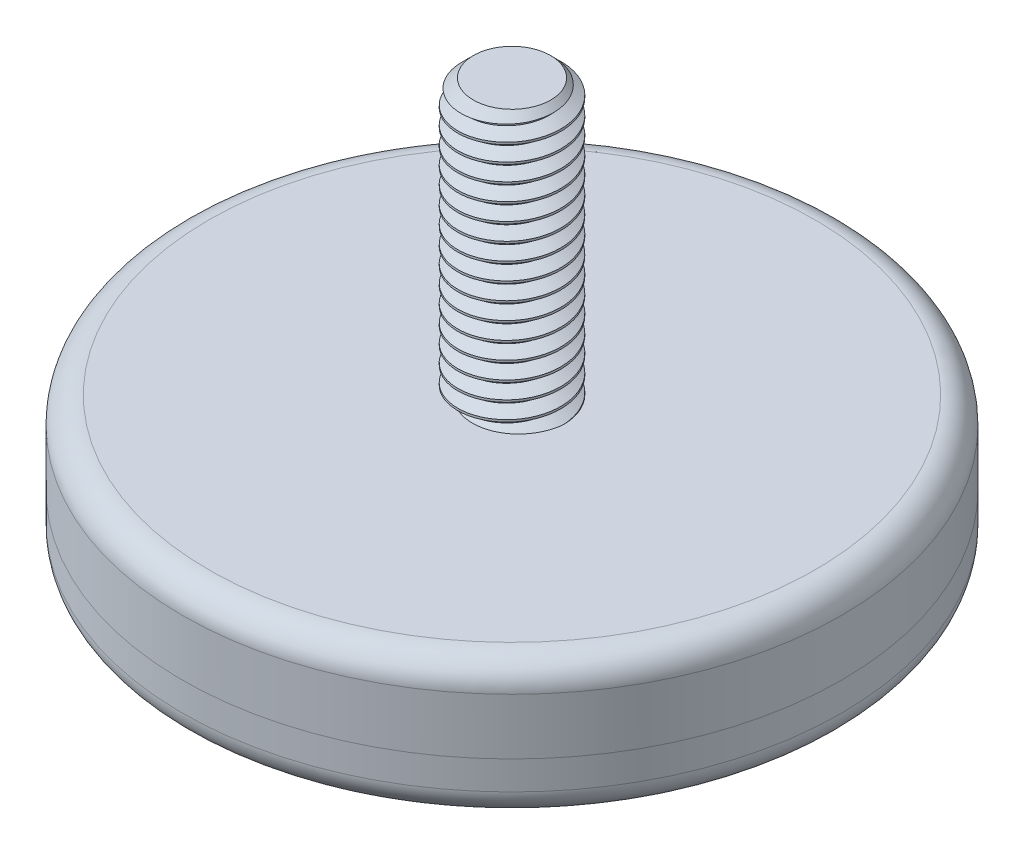
from build123d import *

# Parameters (mm, degrees)
SKETCH1_W               = 4.7625
SKETCH1_H               = 38.1
CUT_SWEEP4_PITCH        = 1.5875
CUT_EXTRUDE1_DEPTH      = 39.690733025
CUT_EXTRUDE1_DEPTH_BACK = 39.690733025
SKETCH5_W               = 2.316222992
SKETCH5_H               = 12.7
SKETCH6_W               = 30.48
SKETCH6_H               = 7.62
FILLET1_R               = 2.4384
SKETCH8_W               = 30.48
SKETCH8_H               = 5.08
SKETCH8_3_W             = 30.48
SKETCH8_3_H             = 5.08
FILLET2_R               = 2.4384


with BuildPart() as part:
    # Sketch1 → Revolve1 (revolve)
    with BuildSketch(Plane.XY):
        with Locations((2.38125, 19.05)):
            Rectangle(SKETCH1_W, SKETCH1_H)
    revolve(axis=Axis((0, 0, 0), (0, 1, 0)))

    # Cut-Sweep4: arcs per turn and ends read off the stored shape
    # Cut-Sweep4: the profile of Sketch4 profile screwed along a right-hand helix through 26 turns, 8 arcs to a turn; built about Z, then put on its axis
    cut_sweep4_z = Axis((0, 0, 0), (0, 0, 1))
    cut_sweep4_corners = [(4.7628, 0, -1.587326795), (3.731388504, 0, -2.1828125), (3.731388504, 0, -2.38125), (4.7628, 0, -2.976735705)]
    with BuildLine(mode=Mode.PRIVATE) as cut_sweep4_profile:
        Line(cut_sweep4_corners[0], cut_sweep4_corners[1])
        Line(cut_sweep4_corners[1], cut_sweep4_corners[2])
        Line(cut_sweep4_corners[2], cut_sweep4_corners[3])
        Line(cut_sweep4_corners[3], cut_sweep4_corners[0])
    cut_sweep4_cap = Face(cut_sweep4_profile.wire())
    cut_sweep4_turn_angles = [0, 22.5, 45, 67.5, 90, 112.5, 135, 157.5, 180, 202.5, 225, 247.5, 270, 292.5, 315, 337.5, 360]
    cut_sweep4_turn_weights = [1, 0.9238795325112867, 1, 0.9238795325112867, 1, 0.9238795325112867, 1, 0.9238795325112867, 1, 0.9238795325112867, 1, 0.9238795325112867, 1, 0.9238795325112867, 1, 0.9238795325112867, 1]
    cut_sweep4_turn_rails = [Edge.make_bspline([Vector(p[0], p[1], 0).rotate(cut_sweep4_z, cut_sweep4_turn_angles[k]) / cut_sweep4_turn_weights[k] + Vector(0, 0, p[2] + CUT_SWEEP4_PITCH * cut_sweep4_turn_angles[k] / 360) for k in range(17)], [0, 0, 0, 1, 1, 2, 2, 3, 3, 4, 4, 5, 5, 6, 6, 7, 7, 8, 8, 8], 2, cut_sweep4_turn_weights) for p in cut_sweep4_corners]
    cut_sweep4_turn_sides = [Face.make_surface_from_curves(cut_sweep4_turn_rails[p[0]], cut_sweep4_turn_rails[p[1]]) for p in [(0, 1), (1, 2), (2, 3), (3, 0)]]
    cut_sweep4 = Plane(origin=(0, 38.1, 0), x_dir=(1, 0, 0), z_dir=(0, -1, 0)) * Solid(Shell([*[p.moved(Location((0, 0, CUT_SWEEP4_PITCH * i))) for i in range(26) for p in cut_sweep4_turn_sides], cut_sweep4_cap, cut_sweep4_cap.rotate(cut_sweep4_z, 9360).moved(Location((0, 0, CUT_SWEEP4_PITCH * 9360 / 360)))]))
    add(cut_sweep4, mode=Mode.SUBTRACT)

    # Sketch9 → Cut-Revolve2 (revolve, cut)
    with BuildSketch(Plane.XY):
        Polygon((4.7625, 36.909375), (3.571875, 38.1), (4.7625, 38.1), align=None)
    revolve(axis=Axis((0, 0, 0), (0, 1, 0)), mode=Mode.SUBTRACT)

    # Sketch5 → Cut-Extrude1 (cut, two sides: drawn at the far end of the back side and taken through both)
    with BuildSketch(Plane(origin=(0, 0, 0), x_dir=(0, 0, -1), z_dir=(1, 0, 0)).offset(-CUT_EXTRUDE1_DEPTH_BACK)):
        with Locations((-4.7625, 6.35)):
            Rectangle(SKETCH5_W, SKETCH5_H)
        with Locations((4.7625, 6.35)):
            Rectangle(SKETCH5_W, SKETCH5_H)
    extrude(amount=CUT_EXTRUDE1_DEPTH + CUT_EXTRUDE1_DEPTH_BACK, mode=Mode.SUBTRACT)

    # Sketch6 → Revolve2 (revolve)
    with BuildSketch(Plane.XY):
        with Locations((15.24, 8.89)):
            Rectangle(SKETCH6_W, SKETCH6_H)
    revolve(axis=Axis((0, 0, 0), (0, 1, 0)))

    # Fillet1
    fillet1_edges = [part.edges().sort_by_distance(p)[0] for p in [
        (-30.48, 12.7, 0),
    ]]
    fillet(fillet1_edges, radius=FILLET1_R)

    # Sketch8<3> → Cut-Revolve1 (revolve, cut)
    with BuildSketch(Plane.XY, mode=Mode.PRIVATE) as cut_revolve1_sk:
        with Locations((15.24, 2.54)):
            Rectangle(SKETCH8_3_W, SKETCH8_3_H)
    revolve(cut_revolve1_sk.sketch.rotate(Axis((0, 0, 0), (0, 1, 0)), 180), axis=Axis((0, 0, 0), (0, 1, 0)), mode=Mode.SUBTRACT)


with BuildPart() as body_2:
    # Sketch8 → Revolve3 (revolve)
    with BuildSketch(Plane.XY):
        with Locations((15.24, 2.54)):
            Rectangle(SKETCH8_W, SKETCH8_H)
    revolve(axis=Axis((0, 0, 0), (0, 1, 0)))

    # Fillet2
    fillet2_edges = [body_2.edges().sort_by_distance(p)[0] for p in [
        (-30.48, 0, 0),
    ]]
    fillet(fillet2_edges, radius=FILLET2_R)


solid = Compound([part.part, body_2.part])
